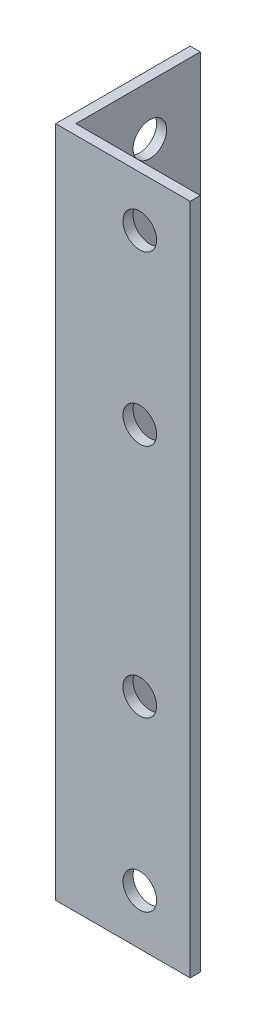
from build123d import *

# Parameters (mm, degrees)
EXTRUDE_1_DEPTH     = 200
SKETCH_2_R          = 5
CUT_EXTRUDE_1_DEPTH = 208.846096908
SKETCH_3_R          = 5
CUT_EXTRUDE_2_DEPTH = 208.846096908


with BuildPart() as part:
    # Эскиз1 → Вытянуть-Тонкостенный1 (new body)
    with BuildSketch(Plane(origin=(0, 0, 0), x_dir=(1, 0, 0), z_dir=(0, 1, 0))):
        Polygon((0, 40), (0, 0), (40, 0), (40, 3), (3, 3), (3, 40), align=None)
    extrude(amount=EXTRUDE_1_DEPTH)

    # Эскиз2 → Вырез-Вытянуть1 (cut, through all)
    with BuildSketch(Plane.ZY):
        with Locations((-25, 15)):
            Circle(SKETCH_2_R)
        with Locations((-25, 65)):
            Circle(SKETCH_2_R)
        with Locations((-25, 135)):
            Circle(SKETCH_2_R)
        with Locations((-25, 185)):
            Circle(SKETCH_2_R)
    extrude(amount=-CUT_EXTRUDE_1_DEPTH, mode=Mode.SUBTRACT)

    # Эскиз3 → Вырез-Вытянуть2 (cut, through all)
    with BuildSketch(Plane.XY):
        with Locations((25, 15)):
            Circle(SKETCH_3_R)
        with Locations((25, 65)):
            Circle(SKETCH_3_R)
        with Locations((25, 135)):
            Circle(SKETCH_3_R)
        with Locations((25, 185)):
            Circle(SKETCH_3_R)
    extrude(amount=-CUT_EXTRUDE_2_DEPTH, mode=Mode.SUBTRACT)


solid = part.part
